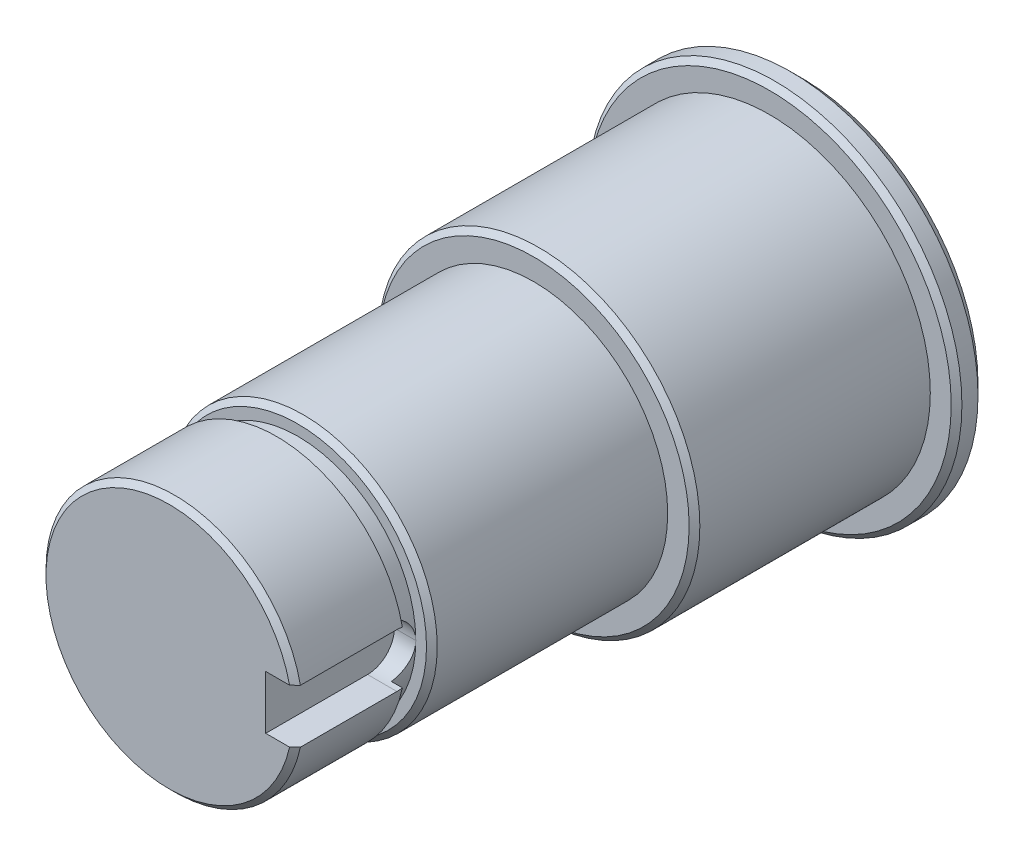
from build123d import *

# Parameters (mm, degrees)
SKETCH_1_R          = 17.45
EXTRUDE_1_DEPTH     = 3
SKETCH_2_R          = 15
EXTRUDE_2_DEPTH     = 22
SKETCH_4_R          = 12.5
EXTRUDE_3_DEPTH     = 22
SKETCH_5_R          = 12
EXTRUDE_4_DEPTH     = 12
CHAMFER_1_SIZE      = 0.5
SKETCH_6_W          = 1
SKETCH_6_H          = 2
CHAMFER_2_SIZE      = 0.5
CHAMFER_3_SIZE      = 1
SKETCH_7_W          = 12
SKETCH_7_H          = 5
CUT_EXTRUDE_1_DEPTH = 3
FILLET_1_R          = 2.5


with BuildPart() as part:
    # 草图1 → 拉伸1 (new body)
    with BuildSketch(Plane.XY):
        Circle(SKETCH_1_R)
    extrude(amount=EXTRUDE_1_DEPTH)

    # 草图2 → 拉伸2 (add)
    with BuildSketch(Plane.XY.offset(3)):
        Circle(SKETCH_2_R)
    extrude(amount=EXTRUDE_2_DEPTH)

    # 草图4 → 拉伸3 (add)
    with BuildSketch(Plane.XY.offset(25)):
        Circle(SKETCH_4_R)
    extrude(amount=EXTRUDE_3_DEPTH)

    # 草图5 → 拉伸4 (add)
    with BuildSketch(Plane.XY.offset(47)):
        Circle(SKETCH_5_R)
    extrude(amount=EXTRUDE_4_DEPTH)

    # 倒角1
    chamfer_1_edges = [part.edges().sort_by_distance(p)[0] for p in [
        (-12, 0, 59),
    ]]
    chamfer(chamfer_1_edges, length=CHAMFER_1_SIZE)

    # 草图6 → 切除-旋转1 (revolve, cut)
    with BuildSketch(Plane(origin=(0, 0, 0), x_dir=(1, 0, 0), z_dir=(0, 1, 0)), mode=Mode.PRIVATE) as cut_revolve_1_sk:
        with Locations((-11.5, -48)):
            Rectangle(SKETCH_6_W, SKETCH_6_H)
    revolve(cut_revolve_1_sk.sketch.rotate(Axis((0, 0, 47), (0, 0, -1)), 180), axis=Axis((0, 0, 47), (0, 0, -1)), mode=Mode.SUBTRACT)

    # 倒角2
    chamfer_2_edges = [part.edges().sort_by_distance(p)[0] for p in [
        (-12.5, 0, 47),
        (-17.45, 0, 3),
        (-15, 0, 25),
    ]]
    chamfer(chamfer_2_edges, length=CHAMFER_2_SIZE)

    # 倒角3
    chamfer_3_edges = [part.edges().sort_by_distance(p)[0] for p in [
        (-17.45, 0, 0),
    ]]
    chamfer(chamfer_3_edges, length=CHAMFER_3_SIZE)

    # 草图7 → 切除-拉伸1 (cut)
    with BuildSketch(Plane(origin=(12, 0, 0), x_dir=(0, 0, -1), z_dir=(1, 0, 0))):
        with Locations((-53, 0)):
            Rectangle(SKETCH_7_W, SKETCH_7_H)
    extrude(amount=-CUT_EXTRUDE_1_DEPTH, mode=Mode.SUBTRACT)

    # 圆角1
    # the kernel refuses this fillet: 2.5 mm, written as the material it adds along each edge
    with BuildSketch(Plane(origin=(16.962142643, -2.5, 47), x_dir=(0, 1, 0), z_dir=(-1, 0, 0))) as fillet_1_piece_1_section:
        with BuildLine():
            CenterArc((FILLET_1_R, -FILLET_1_R), FILLET_1_R, 90, 90)
            Line((0, -FILLET_1_R), (0, 0))
            Line((0, 0), (FILLET_1_R, 0))
        make_face()
    fillet_1_piece_1 = extrude(amount=14.212142643, mode=Mode.PRIVATE)
    fillet_1_piece_1 = fillet_1_piece_1 & Plane(origin=(0, 0, 49.124758418), x_dir=(1, 0, 0), z_dir=(0, 0, -1)) * Cylinder(12, 39, mode=Mode.PRIVATE)
    fillet_1_piece_1 = split(fillet_1_piece_1, bisect_by=Plane(origin=(11.227777132, -2.484876178, 49), z_dir=(0, 0, 1)), keep=Keep.TOP, mode=Mode.PRIVATE)
    add(fillet_1_piece_1)
    with BuildSketch(Plane(origin=(16.962142643, -2.5, 47), x_dir=(0, 1, 0), z_dir=(-1, 0, 0))) as fillet_1_piece_2_section:
        with BuildLine():
            CenterArc((FILLET_1_R, -FILLET_1_R), FILLET_1_R, 90, 90)
            Line((0, -FILLET_1_R), (0, 0))
            Line((0, 0), (FILLET_1_R, 0))
        make_face()
    fillet_1_piece_2 = extrude(amount=14.212142643, mode=Mode.PRIVATE)
    fillet_1_piece_2 = fillet_1_piece_2 & Plane(origin=(0, 0, 48.528388409), x_dir=(1, 0, 0), z_dir=(0, 0, 1)) * Cylinder(11, 39, mode=Mode.PRIVATE)
    add(fillet_1_piece_2)
    with BuildSketch(Plane(origin=(16.962142643, 2.5, 47), x_dir=(0, -1, 0), z_dir=(-1, 0, 0))) as fillet_1_piece_3_section:
        with BuildLine():
            CenterArc((FILLET_1_R, FILLET_1_R), FILLET_1_R, 180, 90)
            Line((0, FILLET_1_R), (0, 0))
            Line((0, 0), (FILLET_1_R, 0))
        make_face()
    fillet_1_piece_3 = extrude(amount=14.212142643, mode=Mode.PRIVATE)
    fillet_1_piece_3 = fillet_1_piece_3 & Plane(origin=(0, 0, 49.124758418), x_dir=(1, 0, 0), z_dir=(0, 0, -1)) * Cylinder(12, 39, mode=Mode.PRIVATE)
    fillet_1_piece_3 = split(fillet_1_piece_3, bisect_by=Plane(origin=(11.227777136, 2.484876178, 49), z_dir=(0, 0, 1)), keep=Keep.TOP, mode=Mode.PRIVATE)
    add(fillet_1_piece_3)
    with BuildSketch(Plane(origin=(16.962142643, 2.5, 47), x_dir=(0, -1, 0), z_dir=(-1, 0, 0))) as fillet_1_piece_4_section:
        with BuildLine():
            CenterArc((FILLET_1_R, FILLET_1_R), FILLET_1_R, 180, 90)
            Line((0, FILLET_1_R), (0, 0))
            Line((0, 0), (FILLET_1_R, 0))
        make_face()
    fillet_1_piece_4 = extrude(amount=14.212142643, mode=Mode.PRIVATE)
    fillet_1_piece_4 = fillet_1_piece_4 & Plane(origin=(0, 0, 48.5283884), x_dir=(1, 0, 0), z_dir=(0, 0, 1)) * Cylinder(11, 39, mode=Mode.PRIVATE)
    add(fillet_1_piece_4)


solid = part.part
